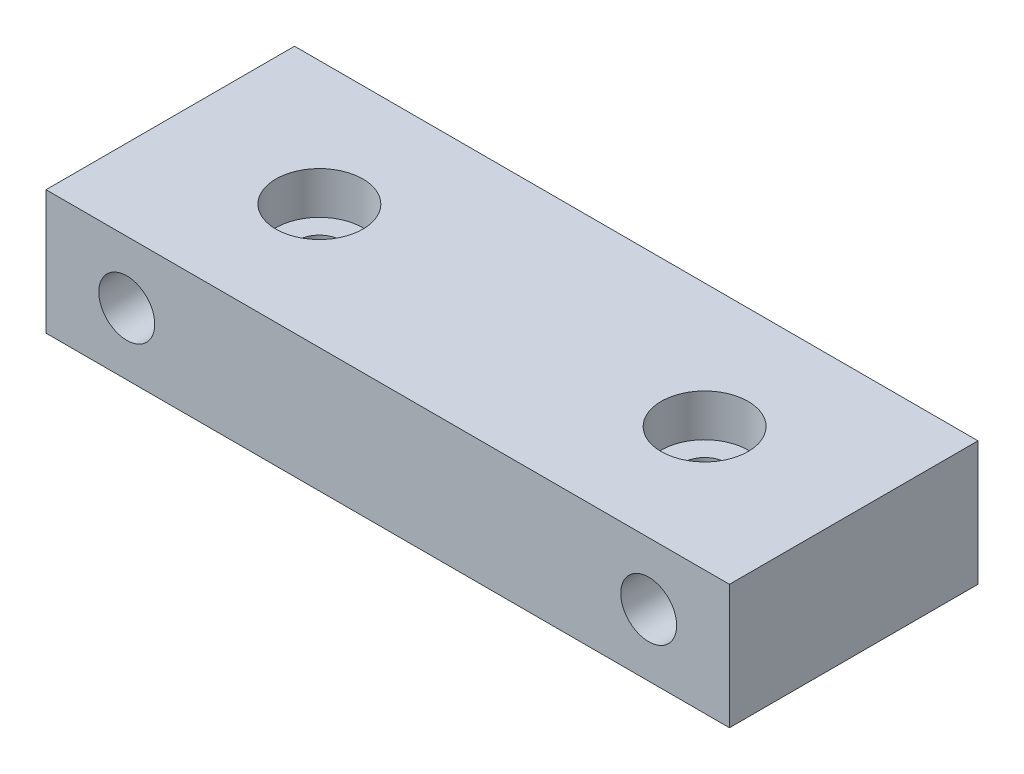
from build123d import *

# Parameters (mm, degrees)
SKETCH1_W                                           = 55
SKETCH1_H                                           = 20
BOSS_EXTRUDE1_DEPTH                                 = 10
SKETCH2_R                                           = 2.25
CUT_EXTRUDE1_DEPTH                                  = 36.443617197
SKETCH3_R                                           = 1.75
CUT_EXTRUDE2_DEPTH                                  = 31.923292192
CBORE_FOR_M3_HEX_SOCKET_HEAD_CAP_SCREW1_D           = 3.4
CBORE_FOR_M3_HEX_SOCKET_HEAD_CAP_SCREW1_CBORE_D     = 7
CBORE_FOR_M3_HEX_SOCKET_HEAD_CAP_SCREW1_CBORE_DEPTH = 3.4
CUT_EXTRUDE3_DEPTH                                  = 4


with BuildPart() as part:
    # Sketch1 → Boss-Extrude1 (new body)
    with BuildSketch(Plane(origin=(0, 0, 0), x_dir=(1, 0, 0), z_dir=(0, 1, 0))):
        Rectangle(SKETCH1_W, SKETCH1_H)
    extrude(amount=BOSS_EXTRUDE1_DEPTH)

    # Sketch2 → Cut-Extrude1 (cut, through all)
    with BuildSketch(Plane.XY.offset(10)):
        with Locations((-21, 5)):
            Circle(SKETCH2_R)
        with Locations((21, 5)):
            Circle(SKETCH2_R)
    extrude(amount=-CUT_EXTRUDE1_DEPTH, mode=Mode.SUBTRACT)

    # Sketch3 → Cut-Extrude2 (cut, through all)
    with BuildSketch(Plane(origin=(0, 10, 0), x_dir=(1, 0, 0), z_dir=(0, 1, 0))):
        with Locations((-15.5, 0)):
            Circle(SKETCH3_R)
        with Locations((15.5, 0)):
            Circle(SKETCH3_R)
    extrude(amount=-CUT_EXTRUDE2_DEPTH, mode=Mode.SUBTRACT)

    # CBORE for M3 Hex Socket Head Cap Screw1 (through all)
    with Locations(Plane(origin=(0, 10, 0), x_dir=(1, 0, 0), z_dir=(0, 1, 0))):
        with Locations((-15.5, 0), (15.5, 0)):
            CounterBoreHole(CBORE_FOR_M3_HEX_SOCKET_HEAD_CAP_SCREW1_D / 2, CBORE_FOR_M3_HEX_SOCKET_HEAD_CAP_SCREW1_CBORE_D / 2, CBORE_FOR_M3_HEX_SOCKET_HEAD_CAP_SCREW1_CBORE_DEPTH)

    # Sketch6 → Cut-Extrude3 (cut)
    with BuildSketch(Plane(origin=(0, 0, -10), x_dir=(-1, 0, 0), z_dir=(0, 0, -1))):
        Polygon((-16.381197846, 5), (-18.690598923, 9), (-23.309401077, 9), (-25.618802154, 5), (-23.309401077, 1), (-18.690598923, 1), align=None)
        Polygon((16.381197846, 5), (18.690598923, 1), (23.309401077, 1), (25.618802154, 5), (23.309401077, 9), (18.690598923, 9), align=None)
    extrude(amount=-CUT_EXTRUDE3_DEPTH, mode=Mode.SUBTRACT)


solid = part.part
